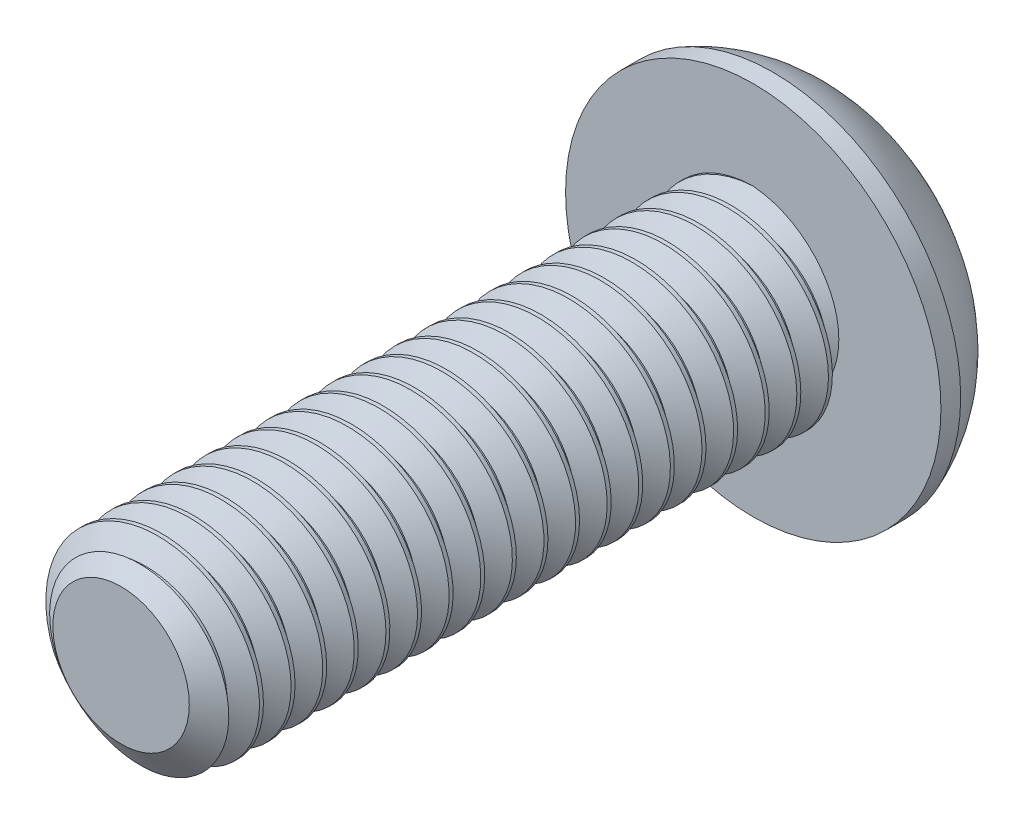
from build123d import *

# Parameters (mm, degrees)
SKETCH1_R          = 2.5
EXTRUDE1_DEPTH     = 16
CUT_SWEEP1_PITCH   = 0.8000000000000066
SKETCH6_R          = 4.75
EXTRUDE2_DEPTH     = 2.75
CUT_EXTRUDE1_DEPTH = 2.25
SKETCH8_R          = 1.7320508075688772
CUT_EXTRUDE2_DEPTH = 20.917015480488036
CUT_EXTRUDE2_TAPER = 45.0000000000001


with BuildPart() as part:
    # Sketch1 → Extrude1 (new body)
    with BuildSketch(Plane.XY):
        Circle(SKETCH1_R)
    extrude(amount=-EXTRUDE1_DEPTH)

    # Cut-Sweep1: arcs per turn and ends read off the stored shape
    # Cut-Sweep1: the profile of Sketch3 profile screwed along a right-hand helix through 23 turns, 6 arcs to a turn; built about Z, then put on its axis
    cut_sweep1_z = Axis((0, 0, 0), (0, 0, 1))
    cut_sweep1_corners = [(2.5003, 0, -1.500173205), (1.980384758, 0, -1.2), (1.980384758, 0, -1.1), (2.5003, 0, -0.799826795)]
    with BuildLine(mode=Mode.PRIVATE) as cut_sweep1_profile:
        Line(cut_sweep1_corners[0], cut_sweep1_corners[1])
        Line(cut_sweep1_corners[1], cut_sweep1_corners[2])
        Line(cut_sweep1_corners[2], cut_sweep1_corners[3])
        Line(cut_sweep1_corners[3], cut_sweep1_corners[0])
    cut_sweep1_cap = Face(cut_sweep1_profile.wire())
    cut_sweep1_turn_angles = [0, 30, 60, 90, 120, 150, 180, 210, 240, 270, 300, 330, 360]
    cut_sweep1_turn_weights = [1, 0.8660254037844387, 1, 0.8660254037844387, 1, 0.8660254037844387, 1, 0.8660254037844387, 1, 0.8660254037844387, 1, 0.8660254037844387, 1]
    cut_sweep1_turn_rails = [Edge.make_bspline([Vector(p[0], p[1], 0).rotate(cut_sweep1_z, cut_sweep1_turn_angles[k]) / cut_sweep1_turn_weights[k] + Vector(0, 0, p[2] + CUT_SWEEP1_PITCH * cut_sweep1_turn_angles[k] / 360) for k in range(13)], [0, 0, 0, 1, 1, 2, 2, 3, 3, 4, 4, 5, 5, 6, 6, 6], 2, cut_sweep1_turn_weights) for p in cut_sweep1_corners]
    cut_sweep1_turn_sides = [Face.make_surface_from_curves(cut_sweep1_turn_rails[p[0]], cut_sweep1_turn_rails[p[1]]) for p in [(0, 1), (1, 2), (2, 3), (3, 0)]]
    cut_sweep1 = Plane(origin=(0, 0, 0), x_dir=(-3.49e-15, 1, 0), z_dir=(0, 0, -1)) * Solid(Shell([*[p.moved(Location((0, 0, CUT_SWEEP1_PITCH * i))) for i in range(23) for p in cut_sweep1_turn_sides], cut_sweep1_cap, cut_sweep1_cap.rotate(cut_sweep1_z, 8280).moved(Location((0, 0, CUT_SWEEP1_PITCH * 8280 / 360)))]))
    add(cut_sweep1, mode=Mode.SUBTRACT)

    # Sketch4 → Cut-Revolve1 (revolve, cut)
    with BuildSketch(Plane(origin=(0, 0, 0), x_dir=(0, 0, -1), z_dir=(1, 0, 0)), mode=Mode.PRIVATE) as cut_revolve1_sk:
        Polygon((0.5416912243118478, 2.5), (0, 1.7263847577293348), (0, 2.5), align=None)
    revolve(cut_revolve1_sk.sketch.rotate(Axis((0, 0, 0), (0, 0, -1)), 260.43858876), axis=Axis((0, 0, 0), (0, 0, -1)), mode=Mode.SUBTRACT)

    # Sketch6 → Extrude2 (add)
    with BuildSketch(Plane(origin=(0, 0, -16), x_dir=(-1, 0, 0), z_dir=(0, 0, -1))):
        Circle(SKETCH6_R)
    extrude(amount=EXTRUDE2_DEPTH)

    # Sketch10 → Cut-Revolve2 (revolve, cut)
    with BuildSketch(Plane(origin=(0, 0, 0), x_dir=(0, 0, -1), z_dir=(1, 0, 0)), mode=Mode.PRIVATE) as cut_revolve2_sk:
        with BuildLine():
            Line((16.5, 4.75), (16.5, 5.25))
            Line((16.5, 5.25), (19.25, 5.25))
            Line((19.25, 5.25), (19.25, 1.5000000000000004))
            Line((19.25, 1.5000000000000004), (18.75, 1.5000000000000004))
            ThreePointArc((18.75, 1.5000000000000004), (18.132611776540898, 3.4764235376052377), (16.5, 4.75))
        make_face()
    revolve(cut_revolve2_sk.sketch.rotate(Axis((0, 0, 0), (0, 0, -1)), 90), axis=Axis((0, 0, 0), (0, 0, -1)), mode=Mode.SUBTRACT)

    # Sketch7 → Cut-Extrude1 (cut)
    with BuildSketch(Plane(origin=(0, 0, -18.75), x_dir=(-1, 0, 0), z_dir=(0, 0, -1))):
        Polygon((-9e-17, 1.732050807568877), (-1.4999999999999998, 0.8660254037844387), (-1.4999999999999998, -0.8660254037844388), (-2.1e-16, -1.7320508075688774), (1.5000000000000002, -0.8660254037844387), (1.4999999999999996, 0.8660254037844388), align=None)
    extrude(amount=-CUT_EXTRUDE1_DEPTH, mode=Mode.SUBTRACT)

    # Sketch8 → Cut-Extrude2 (cut, through all)
    with BuildSketch(Plane.XY.offset(-18.75)):
        Circle(SKETCH8_R)
    extrude(amount=CUT_EXTRUDE2_DEPTH, taper=CUT_EXTRUDE2_TAPER, mode=Mode.SUBTRACT)


solid = part.part
